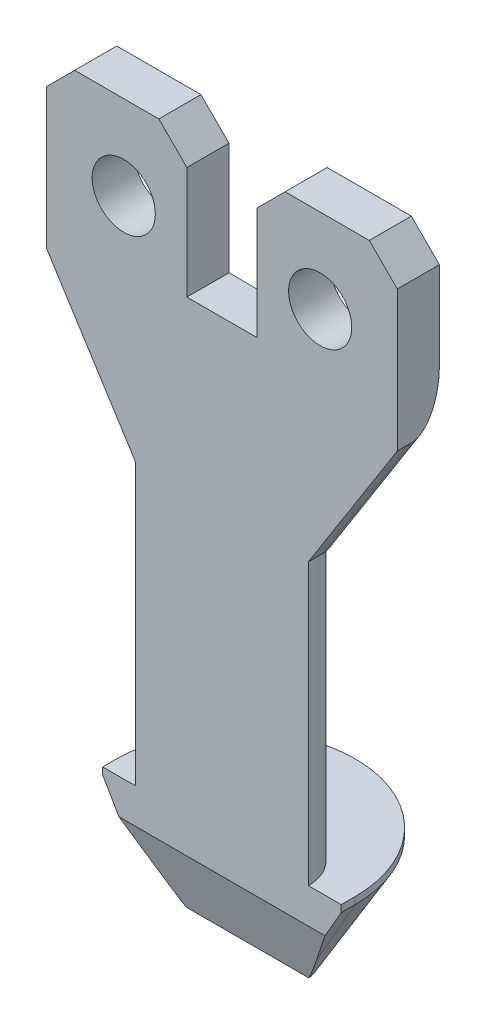
from build123d import *
from OCP.BRepFilletAPI import BRepFilletAPI_MakeChamfer

# Parameters (mm, degrees)
SKETCH1_R           = 2.25
BOSS_EXTRUDE1_DEPTH = 3
BOSS_EXTRUDE2_DEPTH = 3
BOSS_EXTRUDE3_DEPTH = 7.5
CHAMFER1_SIZE       = 7
CHAMFER1_SIZE2      = 4.041451884
CUT_EXTRUDE1_DEPTH  = 47.864827652
FILLET1_R           = 3
CHAMFER2_SIZE       = 2
CHAMFER2_SIZE2      = 2.328114762
CHAMFER3_SIZE       = 5
CHAMFER3_SIZE2      = 1.819851171
CUT_EXTRUDE2_DEPTH  = 47.864827652
FILLET2_R           = 2


with BuildPart() as part:
    # Sketch1 → Boss-Extrude1 (new body)
    with BuildSketch(Plane.XY):
        Polygon((2.018448149, -5.059414071), (-2.981551851, -5.059414071), (-2.981551851, 4.940585929), (-12.981551851, 4.940585929), (-12.981551851, -7.059414071), (12.018448149, -7.059414071), (12.018448149, 4.940585929), (2.018448149, 4.940585929), align=None)
        with Locations((6.518448149, -1.059414071)):
            Circle(SKETCH1_R, mode=Mode.SUBTRACT)
        with Locations((-7.481551851, -1.059414071)):
            Circle(SKETCH1_R, mode=Mode.SUBTRACT)
    extrude(amount=BOSS_EXTRUDE1_DEPTH)

    # Sketch2 → Boss-Extrude2 (add, through all)
    with BuildSketch(Plane.XY.offset(3)):
        Polygon((-12.981551851, -7.059414071), (-8.981551851, -37.059414071), (8.018448149, -37.059414071), (12.018448149, -7.059414071), align=None)
    extrude(amount=-BOSS_EXTRUDE2_DEPTH)

    # Sketch4 → Boss-Extrude3 (add)
    with BuildSketch(Plane.XZ.offset(37.059414071)):
        with BuildLine():
            Line((-8.981551851, 2), (-8.981551851, 3))
            Line((-8.981551851, 3), (8.018448149, 3))
            Line((8.018448149, 3), (8.018448149, 2))
            ThreePointArc((8.018448149, 2), (-0.481551851, -6.5), (-8.981551851, 2))
        make_face()
    extrude(amount=BOSS_EXTRUDE3_DEPTH)

    # Chamfer1: one chamfer whose edges measure the first distance from different faces: ONE call of the kernel's chamfer builder (chamfer() names one face for all edges)
    chamfer1_edges_1 = [part.edges().sort_by_distance(p)[0] for p in [
        (-0.481551851, -44.559414071, -6.5),
    ]]
    chamfer1_side_1 = [part.faces().sort_by_distance(p)[0] for p in [
        (-0.481551851, -40.809414071, -6.5),
    ]]
    chamfer1_edges_2 = [part.edges().sort_by_distance(p)[0] for p in [
        (8.018448149, -44.559414071, 2.5),
    ]]
    chamfer1_side_2 = [part.faces().sort_by_distance(p)[0] for p in [
        (8.018448149, -40.809414071, 2.5),
    ]]
    chamfer1_edges_3 = [part.edges().sort_by_distance(p)[0] for p in [
        (-8.981551851, -44.559414071, 2.5),
    ]]
    chamfer1_side_3 = [part.faces().sort_by_distance(p)[0] for p in [
        (-8.981551851, -40.809414071, 2.5),
    ]]
    chamfer1 = BRepFilletAPI_MakeChamfer(part.part.solid().wrapped)
    for e in chamfer1_edges_1:
        chamfer1.Add(CHAMFER1_SIZE, CHAMFER1_SIZE2, e.wrapped, chamfer1_side_1[0].wrapped)  # the first distance lies on this face
    for e in chamfer1_edges_2:
        chamfer1.Add(CHAMFER1_SIZE, CHAMFER1_SIZE2, e.wrapped, chamfer1_side_2[0].wrapped)  # the first distance lies on this face
    for e in chamfer1_edges_3:
        chamfer1.Add(CHAMFER1_SIZE, CHAMFER1_SIZE2, e.wrapped, chamfer1_side_3[0].wrapped)  # the first distance lies on this face
    add(Compound.cast(chamfer1.Shape()), mode=Mode.REPLACE)

    # Sketch5 → Cut-Extrude1 (cut, through all)
    with BuildSketch(Plane(origin=(0, 0, 0), x_dir=(-1, 0, 0), z_dir=(0, 0, -1))):
        Polygon((6.648218517, -37.059414071), (6.648218517, -17.059414071), (11.648218517, -17.059414071), (8.981551851, -37.059414071), align=None)
        Polygon((-10.685114816, -17.059414071), (-8.018448149, -37.059414071), (-5.685114816, -37.059414071), (-5.685114816, -17.059414071), align=None)
    extrude(amount=-CUT_EXTRUDE1_DEPTH, mode=Mode.SUBTRACT)

    # Fillet1
    fillet1_edges = [part.edges().sort_by_distance(p)[0] for p in [
        (5.685114816, -27.059414071, 0),
        (-6.648218517, -27.059414071, 0),
    ]]
    fillet(fillet1_edges, radius=FILLET1_R - 0.0001)  # a hair under: the kernel refuses the full size

    # Chamfer2: one chamfer whose edges measure the first distance from different faces: ONE call of the kernel's chamfer builder (chamfer() names one face for all edges)
    chamfer2_edges_1 = [part.edges().sort_by_distance(p)[0] for p in [
        (2.018448149, 4.940585929, 1.5),
        (12.018448149, 4.940585929, 1.5),
        (-12.981551851, 4.940585929, 1.5),
        (-2.981551851, 4.940585929, 1.5),
    ]]
    chamfer2_edges_2 = [part.edges().sort_by_distance(p)[0] for p in [
        (-11.648218517, -17.059414071, 1.5),
    ]]
    chamfer2_side_2 = [part.faces().sort_by_distance(p)[0] for p in [
        (-12.314885184, -12.059414071, 1.5),
    ]]
    chamfer2_edges_3 = [part.edges().sort_by_distance(p)[0] for p in [
        (10.685114816, -17.059414071, 1.5),
    ]]
    chamfer2_side_3 = [part.faces().sort_by_distance(p)[0] for p in [
        (7.823515647, -17.059414071, 1.405334343),
    ]]
    chamfer2 = BRepFilletAPI_MakeChamfer(part.part.solid().wrapped)
    for e in chamfer2_edges_1:
        chamfer2.Add(CHAMFER2_SIZE, e.wrapped)
    for e in chamfer2_edges_2:
        chamfer2.Add(CHAMFER2_SIZE, CHAMFER2_SIZE2, e.wrapped, chamfer2_side_2[0].wrapped)  # the first distance lies on this face
    for e in chamfer2_edges_3:
        chamfer2.Add(CHAMFER2_SIZE, CHAMFER2_SIZE2, e.wrapped, chamfer2_side_3[0].wrapped)  # the first distance lies on this face
    add(Compound.cast(chamfer2.Shape()), mode=Mode.REPLACE)

    # Chamfer3
    chamfer3_edges = [part.edges().sort_by_distance(p)[0] for p in [
        (-0.481551851, -44.559414071, 3),
    ]]
    chamfer3_side = [part.faces().sort_by_distance(p)[0] for p in [
        (-0.481914427, -17.452973587, 3),
    ]]
    chamfer(chamfer3_edges, length=CHAMFER3_SIZE, length2=CHAMFER3_SIZE2, reference=chamfer3_side[0])

    # Sketch6 → Cut-Extrude2 (cut, through all)
    with BuildSketch(Plane(origin=(0, 0, 0), x_dir=(-1, 0, 0), z_dir=(0, 0, -1))):
        Polygon((-5.685114816, -17.059414071), (-12.018448149, -7.059414071), (-10.992807124, -14.751721764), (-8.685114816, -17.059414071), align=None)
        Polygon((12.981551851, -7.059414071), (6.648218517, -17.059414071), (9.320103756, -17.059414071), (11.912545957, -15.07695827), align=None)
    extrude(amount=-CUT_EXTRUDE2_DEPTH, mode=Mode.SUBTRACT)

    # Fillet2
    fillet2_edges = [part.edges().sort_by_distance(p)[0] for p in [
        (8.851781483, -12.059414071, 0),
        (-9.814885184, -12.059414071, 0),
    ]]
    fillet(fillet2_edges, radius=FILLET2_R)


solid = part.part
